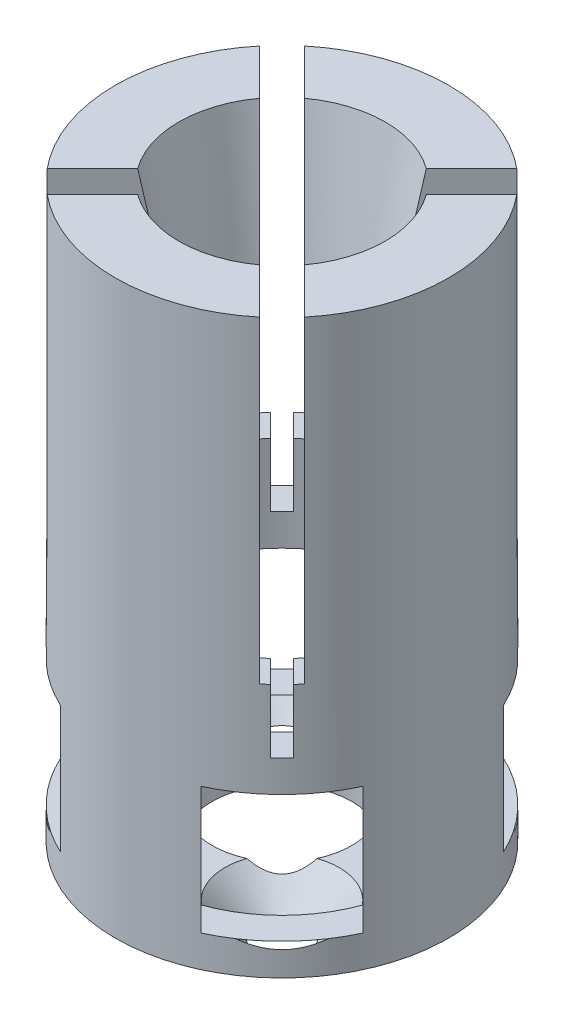
from build123d import *

# Parameters (mm, degrees)
SKETCH1_R           = 16.66875
BOSS_EXTRUDE1_DEPTH = 3.175
SKETCH2_R           = 16.66875
SKETCH2_R_2         = 13.49375
BOSS_EXTRUDE2_DEPTH = 53.975
SKETCH7_R           = 6.985
CUT_EXTRUDE1_DEPTH  = 62.82084562
SKETCH12_R          = 14.2875
BOSS_EXTRUDE7_DEPTH = 25.4
CUT_EXTRUDE2_REACH  = 63.821
SKETCH9_W           = 12.7
SKETCH9_H           = 11.43
SKETCH9_W_2         = 6.35
SKETCH9_H_2         = 1.6002
SKETCH9_W_3         = 152.4
SKETCH9_H_3         = 3.175
CIRPATTERN2_COUNT   = 4
SKETCH5_R           = 2.5527
SKETCH6_R           = 5.715
CIRPATTERN1_COUNT   = 4


with BuildPart() as part:
    # Sketch1 → Boss-Extrude1 (new body)
    with BuildSketch(Plane(origin=(0, 0, 0), x_dir=(1, 0, 0), z_dir=(0, 1, 0))):
        with Locations(Location((0, 0, 0), (0, 0, 270))):
            Circle(SKETCH1_R)
    extrude(amount=BOSS_EXTRUDE1_DEPTH)

    # Sketch2 → Boss-Extrude2 (add)
    with BuildSketch(Plane(origin=(0, 3.175, 0), x_dir=(1, 0, 0), z_dir=(0, 1, 0))):
        with Locations(Location((0, 0, 0), (0, 0, 270))):
            Circle(SKETCH2_R)
        with Locations(Location((0, 0, 0), (0, 0, 270))):
            Circle(SKETCH2_R_2, mode=Mode.SUBTRACT)
    extrude(amount=BOSS_EXTRUDE2_DEPTH)

    # Sketch7 → Cut-Extrude1 (cut, through all)
    with BuildSketch(Plane.XZ):
        with Locations(Location((0, 0, 0), (0, 0, 270))):
            Circle(SKETCH7_R)
    extrude(amount=-CUT_EXTRUDE1_DEPTH, mode=Mode.SUBTRACT)

    # Sketch12 → Boss-Extrude7 (add)
    with BuildSketch(Plane(origin=(0, 31.75, 0), x_dir=(1, 0, 0), z_dir=(0, 1, 0))):
        Circle(SKETCH12_R)
    extrude(amount=BOSS_EXTRUDE7_DEPTH)

    # Cut-Loft2: read off the stored shape, not the designer's step
    # Cut-Loft2: loft between two sections, ruled curve by curve
    cut_loft2_from = [
        Edge.make_bspline([(-0.505569823, 57.15, -10.307628823), (20.109687823, 57.15, -11.318768468), (21.120827469, 57.15, 9.296489178), (0.505569823, 57.15, 10.307628823), (-20.109687823, 57.15, 11.318768468), (-21.120827469, 57.15, -9.296489178), (-0.505569823, 57.15, -10.307628823)], [0, 0, 0, 0, 0.5, 0.5, 0.5, 1, 1, 1, 1], 3, [1, 0.333333333, 0.333333333, 1, 0.333333333, 0.333333333, 1]),
    ]
    cut_loft2_to = [
        Edge.make_bspline([(-3.365363271, 31.75, -5.384870477), (7.404377683, 31.75, -12.115597019), (14.135104225, 31.75, -1.345856065), (3.365363271, 31.75, 5.384870477), (-7.404377683, 31.75, 12.115597019), (-14.135104225, 31.75, 1.345856065), (-3.365363271, 31.75, -5.384870477)], [0, 0, 0, 0, 0.5, 0.5, 0.5, 1, 1, 1, 1], 3, [1, 0.333333333, 0.333333333, 1, 0.333333333, 0.333333333, 1]),
    ]
    cut_loft2 = Solid(Shell([*[Face.make_surface_from_curves(cut_loft2_from[k], cut_loft2_to[k]) for k in range(1)], Face(Wire(cut_loft2_from)), Face(Wire(cut_loft2_to))]))
    add(cut_loft2, mode=Mode.SUBTRACT)

    # Sketch9 → Cut-Extrude2 (cut, up to next)
    with BuildSketch(Plane(origin=(0, 0, 0), x_dir=(0, -1, 0), z_dir=(-0.7071067811865488, 0, 0.7071067811865464)), mode=Mode.PRIVATE) as cut_extrude2_sk1:
        with Locations((-9.52754, 0)):
            Rectangle(SKETCH9_W, SKETCH9_H)
    cut_extrude2_tool1 = extrude(cut_extrude2_sk1.sketch, amount=-CUT_EXTRUDE2_REACH, mode=Mode.PRIVATE) & part.part
    # Sketch9 → Cut-Extrude2 (cut, up to next)
    with BuildSketch(Plane(origin=(0, 0, 0), x_dir=(0, -1, 0), z_dir=(-0.7071067811865488, 0, 0.7071067811865464)), mode=Mode.PRIVATE) as cut_extrude2_sk2:
        with Locations((-22.225, 0)):
            Rectangle(SKETCH9_W_2, SKETCH9_H_2)
    cut_extrude2_tool2 = extrude(cut_extrude2_sk2.sketch, amount=-CUT_EXTRUDE2_REACH, mode=Mode.PRIVATE) & part.part
    # Sketch9 → Cut-Extrude2 (cut, up to next)
    with BuildSketch(Plane(origin=(0, 0, 0), x_dir=(0, -1, 0), z_dir=(-0.7071067811865488, 0, 0.7071067811865464)), mode=Mode.PRIVATE) as cut_extrude2_sk3:
        with Locations((-101.6, 0)):
            Rectangle(SKETCH9_W_3, SKETCH9_H_3)
    cut_extrude2_tool3 = extrude(cut_extrude2_sk3.sketch, amount=-CUT_EXTRUDE2_REACH, mode=Mode.PRIVATE) & part.part
    cut_extrude2_1 = cut_extrude2_tool1.solids().sort_by_distance((0, 9.52754, 0))[0]
    add(cut_extrude2_1, mode=Mode.SUBTRACT)
    cut_extrude2_2 = cut_extrude2_tool2.solids().sort_by_distance((0, 22.225, 0))[0]
    add(cut_extrude2_2, mode=Mode.SUBTRACT)
    cut_extrude2_3 = cut_extrude2_tool3.solids().sort_by_distance((0, 101.6, 0))[0]
    add(cut_extrude2_3, mode=Mode.SUBTRACT)
    cut_extrude2 = cut_extrude2_1 + cut_extrude2_2 + cut_extrude2_3  # Cut-Extrude2 as one shape, for the pattern or mirror that repeats it

    # CirPattern2: Cut-Extrude2 ×4 about axis
    cirpattern2_axis = Axis((0, 0, 0), (0, 1, 0))
    for i in range(1, CIRPATTERN2_COUNT):
        add(cut_extrude2.rotate(cirpattern2_axis, i * 360 / CIRPATTERN2_COUNT), mode=Mode.SUBTRACT)

    # Sketch5 → Cut-Loft1 section 0
    with BuildSketch(Plane.XZ):
        with Locations((8.255, -8.255)):
            Circle(SKETCH5_R)
    # Sketch6 → Cut-Loft1 section 1
    with BuildSketch(Plane(origin=(0, 3.175, 0), x_dir=(1, 0, 0), z_dir=(0, 1, 0))):
        with Locations((8.255, 8.255)):
            Circle(SKETCH6_R)
    cut_loft1 = loft(mode=Mode.SUBTRACT)

    # CirPattern1: Cut-Loft1 ×4 about axis
    cirpattern1_axis = Axis((0, 0, 0), (0, 1, 0))
    for i in range(1, CIRPATTERN1_COUNT):
        add(cut_loft1.rotate(cirpattern1_axis, i * 360 / CIRPATTERN1_COUNT), mode=Mode.SUBTRACT)


solid = part.part
